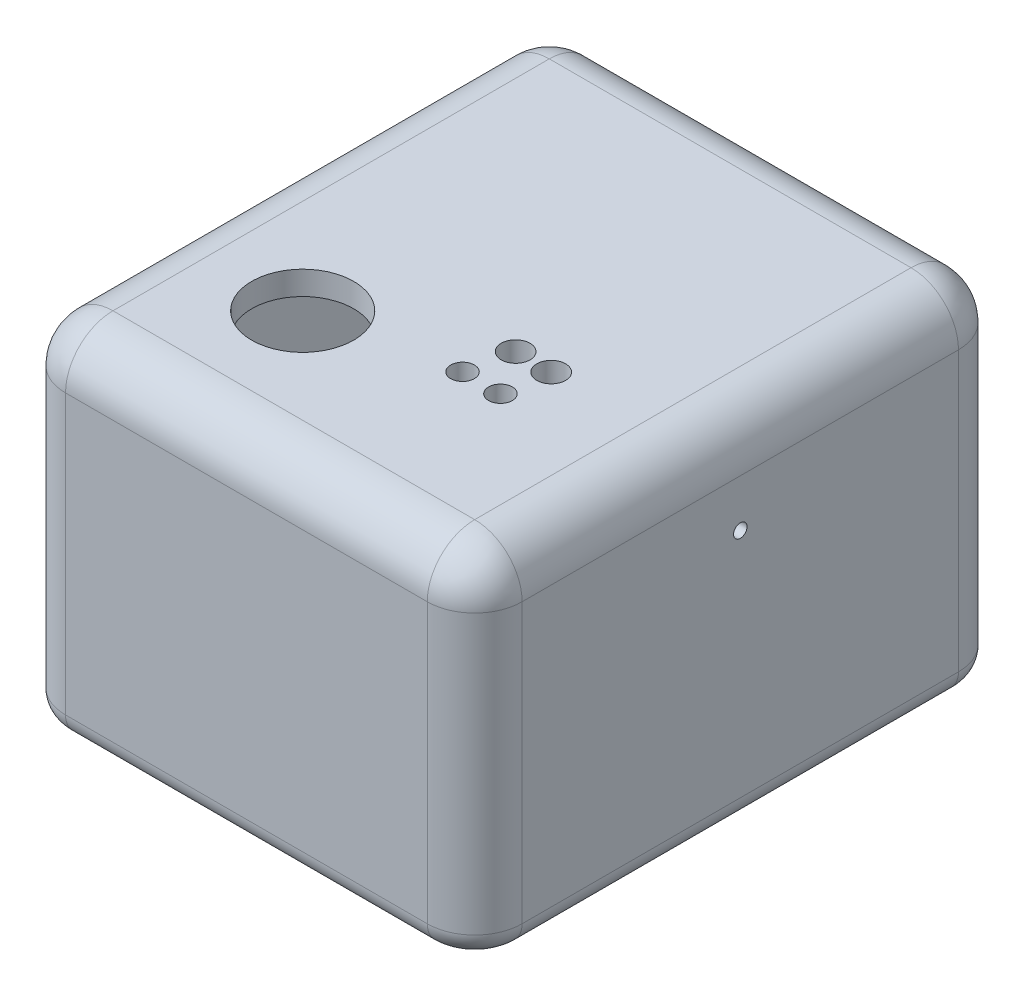
from build123d import *

# Parameters (mm, degrees)
SKETCH1_W           = 96.27
SKETCH1_H           = 112
BOSS_EXTRUDE1_DEPTH = 73.8
SKETCH2_W           = 86.27
SKETCH2_H           = 102
CUT_EXTRUDE1_DEPTH  = 68.8
FILLET1_R           = 10
FILLET2_R           = 10
FILLET3_R           = 7.5
FILLET4_R           = 7.5
FILLET6_R           = 5
SKETCH3_R           = 3.04
CUT_EXTRUDE2_DEPTH  = 5
SKETCH4_R           = 10.75
CUT_EXTRUDE3_DEPTH  = 5
SKETCH5_R           = 2.5
CUT_EXTRUDE4_DEPTH  = 5
HOLE1_START         = 43.135
HOLE1_OUTLINE_R     = 1.4224
HOLE1_DEPTH         = 5


# Read off the part's stored shape, not the designer's step: Hole1
# Some blends are built 0.0001 mm under size
with BuildPart() as part:
    # Sketch1 → Boss-Extrude1 (new body)
    with BuildSketch(Plane(origin=(0, 0, 0), x_dir=(1, 0, 0), z_dir=(0, 1, 0))):
        Rectangle(SKETCH1_W, SKETCH1_H)
    extrude(amount=BOSS_EXTRUDE1_DEPTH)

    # Sketch2 → Cut-Extrude1 (cut)
    with BuildSketch(Plane.XZ):
        Rectangle(SKETCH2_W, SKETCH2_H)
    extrude(amount=-CUT_EXTRUDE1_DEPTH, mode=Mode.SUBTRACT)

    # Fillet1
    fillet1_edges = [part.edges().sort_by_distance(p)[0] for p in [
        (-48.135, 73.8, 0),
        (0, 73.8, 56),
        (48.135, 73.8, 0),
        (0, 73.8, -56),
    ]]
    fillet(fillet1_edges, radius=FILLET1_R)

    # Fillet2
    # the kernel refuses this fillet: 10 mm, written as the material it takes off along each edge
    with BuildSketch(Plane(origin=(38.135, 63.8, 46), x_dir=(1, 0, 0), z_dir=(0, 0, 1))) as fillet2_piece_1_section:
        Polygon((0, 0), (FILLET2_R, 0), (FILLET2_R, FILLET2_R), (0, FILLET2_R), align=None)
    fillet2_piece_1 = extrude(amount=FILLET2_R, mode=Mode.PRIVATE)
    fillet2_piece_1 = fillet2_piece_1 - Plane(origin=(38.135, 63.8, 46), x_dir=(-0.7071067811865475, -0.7071067811865475, 0), z_dir=(0, 0, 1)) * Sphere(FILLET2_R, mode=Mode.PRIVATE)
    add(fillet2_piece_1, mode=Mode.SUBTRACT)
    with BuildSketch(Plane(origin=(-38.135, 63.8, 46), x_dir=(-1, 0, 0), z_dir=(0, 0, 1))) as fillet2_piece_2_section:
        Polygon((0, 0), (FILLET2_R, 0), (FILLET2_R, -FILLET2_R), (0, -FILLET2_R), align=None)
    fillet2_piece_2 = extrude(amount=FILLET2_R, mode=Mode.PRIVATE)
    fillet2_piece_2 = fillet2_piece_2 - Plane(origin=(-38.135, 63.8, 46), x_dir=(0.7071067811865475, -0.7071067811865475, 0), z_dir=(0, 0, 1)) * Sphere(FILLET2_R, mode=Mode.PRIVATE)
    add(fillet2_piece_2, mode=Mode.SUBTRACT)
    with BuildSketch(Plane(origin=(38.135, 63.8, -46), x_dir=(0, 0, -1), z_dir=(1, 0, 0))) as fillet2_piece_3_section:
        Polygon((0, 0), (FILLET2_R, 0), (FILLET2_R, FILLET2_R), (0, FILLET2_R), align=None)
    fillet2_piece_3 = extrude(amount=FILLET2_R, mode=Mode.PRIVATE)
    fillet2_piece_3 = fillet2_piece_3 - Plane(origin=(38.135, 63.8, -46), x_dir=(0, -0.7071067811865475, 0.7071067811865475), z_dir=(1, 0, 0)) * Sphere(FILLET2_R, mode=Mode.PRIVATE)
    add(fillet2_piece_3, mode=Mode.SUBTRACT)
    with BuildSketch(Plane(origin=(-38.135, 63.8, -46), x_dir=(0, 0, -1), z_dir=(-1, 0, 0))) as fillet2_piece_4_section:
        Polygon((0, 0), (FILLET2_R, 0), (FILLET2_R, -FILLET2_R), (0, -FILLET2_R), align=None)
    fillet2_piece_4 = extrude(amount=FILLET2_R, mode=Mode.PRIVATE)
    fillet2_piece_4 = fillet2_piece_4 - Plane(origin=(-38.135, 63.8, -46), x_dir=(0, -0.7071067811865475, 0.7071067811865475), z_dir=(-1, 0, 0)) * Sphere(FILLET2_R, mode=Mode.PRIVATE)
    add(fillet2_piece_4, mode=Mode.SUBTRACT)
    with BuildSketch(Plane(origin=(-48.135, -25, -56), x_dir=(0, 0, 1), z_dir=(0, 1, 0)), Plane(origin=(-48.135, -25, 56), x_dir=(1, 0, 0), z_dir=(0, 1, 0))) as fillet2_piece_5:
        with BuildLine():
            CenterArc((FILLET2_R, FILLET2_R), FILLET2_R, 180, 90)
            Line((0, FILLET2_R), (0, 0))
            Line((0, 0), (FILLET2_R, 0))
        make_face()
    extrude(amount=88.8, mode=Mode.SUBTRACT)
    with BuildSketch(Plane(origin=(48.135, -25, -56), x_dir=(0, 0, 1), z_dir=(0, 1, 0)), Plane(origin=(48.135, -25, 56), x_dir=(-1, 0, 0), z_dir=(0, 1, 0))) as fillet2_piece_6:
        with BuildLine():
            CenterArc((FILLET2_R, -FILLET2_R), FILLET2_R, 90, 90)
            Line((0, -FILLET2_R), (0, 0))
            Line((0, 0), (FILLET2_R, 0))
        make_face()
    extrude(amount=88.8, mode=Mode.SUBTRACT)

    # Fillet3
    fillet3_edges = [part.edges().sort_by_distance(p)[0] for p in [
        (43.135, 68.8, 0),
        (0, 68.8, -51),
        (-43.135, 68.8, 0),
        (0, 68.8, 51),
    ]]
    fillet(fillet3_edges, radius=FILLET3_R)

    # Fillet4
    # the kernel refuses this fillet: 7.5 mm, written as the material it adds along each edge
    with BuildSketch(Plane(origin=(-35.635, 61.3, -43.5), x_dir=(0, 0, -1), z_dir=(-1, 0, 0))) as fillet4_piece_1_section:
        Polygon((0, 0), (FILLET4_R, 0), (FILLET4_R, -FILLET4_R), (0, -FILLET4_R), align=None)
    fillet4_piece_1 = extrude(amount=FILLET4_R, mode=Mode.PRIVATE)
    fillet4_piece_1 = fillet4_piece_1 - Plane(origin=(-35.635, 61.3, -43.5), x_dir=(0, -0.7071067811865475, 0.7071067811865475), z_dir=(-1, 0, 0)) * Sphere(FILLET4_R, mode=Mode.PRIVATE)
    add(fillet4_piece_1)
    with BuildSketch(Plane(origin=(-35.635, 61.3, 43.5), x_dir=(0, 0, 1), z_dir=(-1, 0, 0))) as fillet4_piece_2_section:
        Polygon((0, 0), (FILLET4_R, 0), (FILLET4_R, FILLET4_R), (0, FILLET4_R), align=None)
    fillet4_piece_2 = extrude(amount=FILLET4_R, mode=Mode.PRIVATE)
    fillet4_piece_2 = fillet4_piece_2 - Plane(origin=(-35.635, 61.3, 43.5), x_dir=(0, -0.7071067811865475, -0.7071067811865475), z_dir=(-1, 0, 0)) * Sphere(FILLET4_R, mode=Mode.PRIVATE)
    add(fillet4_piece_2)
    with BuildSketch(Plane(origin=(35.635, 61.3, -43.5), x_dir=(1, 0, 0), z_dir=(0, 0, -1))) as fillet4_piece_3_section:
        Polygon((0, 0), (FILLET4_R, 0), (FILLET4_R, -FILLET4_R), (0, -FILLET4_R), align=None)
    fillet4_piece_3 = extrude(amount=FILLET4_R, mode=Mode.PRIVATE)
    fillet4_piece_3 = fillet4_piece_3 - Plane(origin=(35.635, 61.3, -43.5), x_dir=(-0.7071067811865475, -0.7071067811865475, 0), z_dir=(0, 0, -1)) * Sphere(FILLET4_R, mode=Mode.PRIVATE)
    add(fillet4_piece_3)
    with BuildSketch(Plane(origin=(35.635, 61.3, 43.5), x_dir=(1, 0, 0), z_dir=(0, 0, 1))) as fillet4_piece_4_section:
        Polygon((0, 0), (FILLET4_R, 0), (FILLET4_R, FILLET4_R), (0, FILLET4_R), align=None)
    fillet4_piece_4 = extrude(amount=FILLET4_R, mode=Mode.PRIVATE)
    fillet4_piece_4 = fillet4_piece_4 - Plane(origin=(35.635, 61.3, 43.5), x_dir=(-0.7071067811865475, -0.7071067811865475, 0), z_dir=(0, 0, 1)) * Sphere(FILLET4_R, mode=Mode.PRIVATE)
    add(fillet4_piece_4)
    with BuildSketch(Plane(origin=(43.135, 0, 51), x_dir=(-1, 0, 0), z_dir=(0, 1, 0)), Plane(origin=(-43.135, 0, 51), x_dir=(0, 0, -1), z_dir=(0, 1, 0))) as fillet4_piece_5:
        with BuildLine():
            CenterArc((FILLET4_R, -FILLET4_R), FILLET4_R, 90, 90)
            Line((0, -FILLET4_R), (0, 0))
            Line((0, 0), (FILLET4_R, 0))
        make_face()
    extrude(amount=61.3)
    with BuildSketch(Plane(origin=(43.135, 0, -51), x_dir=(-1, 0, 0), z_dir=(0, 1, 0)), Plane(origin=(-43.135, 0, -51), x_dir=(0, 0, 1), z_dir=(0, 1, 0))) as fillet4_piece_6:
        with BuildLine():
            CenterArc((FILLET4_R, FILLET4_R), FILLET4_R, 180, 90)
            Line((0, FILLET4_R), (0, 0))
            Line((0, 0), (FILLET4_R, 0))
        make_face()
    extrude(amount=61.3)

    # Fillet6
    fillet6_edges = [part.edges().sort_by_distance(p)[0] for p in [
        (-48.135, 0, 0),
        (48.135, 0, 0),
        (0, 0, 56),
        (0, 0, -56),
        (-45.206067812, 0, 53.071067812),
        (45.206067812, 0, 53.071067812),
        (45.206067812, 0, -53.071067812),
        (-45.206067812, 0, -53.071067812),
    ]]
    fillet(fillet6_edges, radius=FILLET6_R - 0.0001)  # a hair under: the kernel refuses the full size

    # Sketch3 → Cut-Extrude2 (cut)
    with BuildSketch(Plane(origin=(0, 73.8, 0), x_dir=(1, 0, 0), z_dir=(0, 1, 0))):
        with Locations(Location((19.265, -11, 0), (0, 0, 270))):
            Circle(SKETCH3_R)
        with Locations(Location((11.765, -11, 0), (0, 0, 270))):
            Circle(SKETCH3_R)
    extrude(amount=-CUT_EXTRUDE2_DEPTH, mode=Mode.SUBTRACT)

    # Sketch4 → Cut-Extrude3 (cut)
    with BuildSketch(Plane(origin=(0, 73.8, 0), x_dir=(1, 0, 0), z_dir=(0, 1, 0))):
        with Locations(Location((-18.135, -26, 0), (0, 0, 270))):
            Circle(SKETCH4_R)
    extrude(amount=-CUT_EXTRUDE3_DEPTH, mode=Mode.SUBTRACT)

    # Sketch5 → Cut-Extrude4 (cut)
    with BuildSketch(Plane(origin=(0, 73.8, 0), x_dir=(1, 0, 0), z_dir=(0, 1, 0))):
        with Locations(Location((9.865, -20.3, 0), (0, 0, 270))):
            Circle(SKETCH5_R)
        with Locations(Location((17.865, -20.3, 0), (0, 0, 270))):
            Circle(SKETCH5_R)
    extrude(amount=-CUT_EXTRUDE4_DEPTH, mode=Mode.SUBTRACT)

    # Hole1 outline → Hole1 (cut)
    with BuildSketch(Plane.YZ.offset(HOLE1_START)):
        with Locations((53.8, 0)):
            Circle(HOLE1_OUTLINE_R)
    extrude(amount=HOLE1_DEPTH, mode=Mode.SUBTRACT)


solid = part.part
